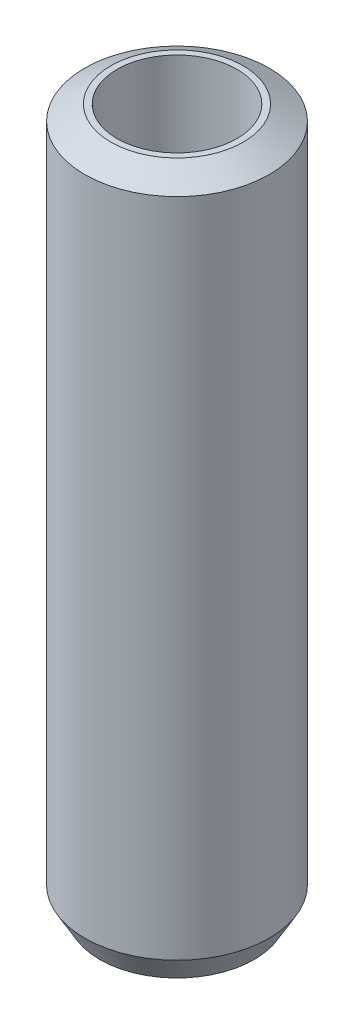
from build123d import *
from OCP.BRepFilletAPI import BRepFilletAPI_MakeChamfer

# Parameters (mm, degrees)
SKETCH1_R           = 32.5
BOSS_EXTRUDE1_DEPTH = 247.459883983
SKETCH2_R           = 21.143172134
CUT_EXTRUDE1_DEPTH  = 252.692062212
CHAMFER1_SIZE       = 5.298142603
CHAMFER1_SIZE2      = 9.176652174


with BuildPart() as part:
    # Sketch1 → Boss-Extrude1 (new body)
    with BuildSketch(Plane(origin=(0, 0, 0), x_dir=(1, 0, 0), z_dir=(0, 1, 0))):
        Circle(SKETCH1_R)
    extrude(amount=BOSS_EXTRUDE1_DEPTH)

    # Sketch2 → Cut-Extrude1 (cut, through all)
    with BuildSketch(Plane(origin=(0, 0, 0), x_dir=(1, 0, 0), z_dir=(0, 1, 0))):
        Circle(SKETCH2_R)
    extrude(amount=CUT_EXTRUDE1_DEPTH, mode=Mode.SUBTRACT)

    # Chamfer1: one chamfer whose edges measure the first distance from different faces: ONE call of the kernel's chamfer builder (chamfer() names one face for all edges)
    chamfer1_edges_1 = [part.edges().sort_by_distance(p)[0] for p in [
        (-32.5, 247.459883983, 0),
    ]]
    chamfer1_side_1 = [part.faces().sort_by_distance(p)[0] for p in [
        (-32.5, 123.729941991, 0),
    ]]
    chamfer1_edges_2 = [part.edges().sort_by_distance(p)[0] for p in [
        (-32.5, 0, 0),
    ]]
    chamfer1_side_2 = [part.faces().sort_by_distance(p)[0] for p in [
        (-31.580761184, 0, 0),
    ]]
    chamfer1 = BRepFilletAPI_MakeChamfer(part.part.solid().wrapped)
    for e in chamfer1_edges_1:
        chamfer1.Add(CHAMFER1_SIZE, CHAMFER1_SIZE2, e.wrapped, chamfer1_side_1[0].wrapped)  # the first distance lies on this face
    for e in chamfer1_edges_2:
        chamfer1.Add(CHAMFER1_SIZE, CHAMFER1_SIZE2, e.wrapped, chamfer1_side_2[0].wrapped)  # the first distance lies on this face
    add(Compound.cast(chamfer1.Shape()), mode=Mode.REPLACE)


solid = part.part
